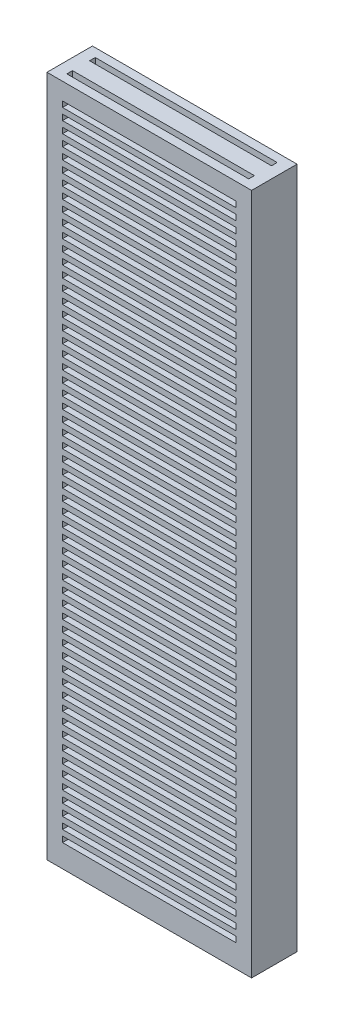
from build123d import *

# Parameters (mm, degrees)
SKETCH1_W                = 9
SKETCH1_H                = 2
BOSS_EXTRUDE1_DEPTH      = 15
SKETCH2_W                = 8
SKETCH2_H                = 0.25
CUT_EXTRUDE1_DEPTH       = 31.352100422
CUT_EXTRUDE2_REACH       = 17.788
SKETCH3_W                = 7.634272068
SKETCH3_H                = 0.25
LPATTERN1_COUNT          = 57
LPATTERN1_PITCH          = 0.5
MIRROR2_COPY_1_REACH     = 17.788
MIRROR2_COPY_1_SKETCH_W  = 7.634272068
MIRROR2_COPY_1_SKETCH_H  = 0.25
MIRROR2_COPY_2_REACH     = 17.788
MIRROR2_COPY_2_SKETCH_W  = 7.634272068
MIRROR2_COPY_2_SKETCH_H  = 0.25
MIRROR2_COPY_3_REACH     = 17.788
MIRROR2_COPY_3_SKETCH_W  = 7.634272068
MIRROR2_COPY_3_SKETCH_H  = 0.25
MIRROR2_COPY_4_REACH     = 17.788
MIRROR2_COPY_4_SKETCH_W  = 7.634272068
MIRROR2_COPY_4_SKETCH_H  = 0.25
MIRROR2_COPY_5_REACH     = 17.788
MIRROR2_COPY_5_SKETCH_W  = 7.634272068
MIRROR2_COPY_5_SKETCH_H  = 0.25
MIRROR2_COPY_6_REACH     = 17.788
MIRROR2_COPY_6_SKETCH_W  = 7.634272068
MIRROR2_COPY_6_SKETCH_H  = 0.25
MIRROR2_COPY_7_REACH     = 17.788
MIRROR2_COPY_7_SKETCH_W  = 7.634272068
MIRROR2_COPY_7_SKETCH_H  = 0.25
MIRROR2_COPY_8_REACH     = 17.788
MIRROR2_COPY_8_SKETCH_W  = 7.634272068
MIRROR2_COPY_8_SKETCH_H  = 0.25
MIRROR2_COPY_9_REACH     = 17.788
MIRROR2_COPY_9_SKETCH_W  = 7.634272068
MIRROR2_COPY_9_SKETCH_H  = 0.25
MIRROR2_COPY_10_REACH    = 17.788
MIRROR2_COPY_10_SKETCH_W = 7.634272068
MIRROR2_COPY_10_SKETCH_H = 0.25
MIRROR2_COPY_11_REACH    = 17.788
MIRROR2_COPY_11_SKETCH_W = 7.634272068
MIRROR2_COPY_11_SKETCH_H = 0.25
MIRROR2_COPY_12_REACH    = 17.788
MIRROR2_COPY_12_SKETCH_W = 7.634272068
MIRROR2_COPY_12_SKETCH_H = 0.25
MIRROR2_COPY_13_REACH    = 17.788
MIRROR2_COPY_13_SKETCH_W = 7.634272068
MIRROR2_COPY_13_SKETCH_H = 0.25
MIRROR2_COPY_14_REACH    = 17.788
MIRROR2_COPY_14_SKETCH_W = 7.634272068
MIRROR2_COPY_14_SKETCH_H = 0.25
MIRROR2_COPY_15_REACH    = 17.788
MIRROR2_COPY_15_SKETCH_W = 7.634272068
MIRROR2_COPY_15_SKETCH_H = 0.25
MIRROR2_COPY_16_REACH    = 17.788
MIRROR2_COPY_16_SKETCH_W = 7.634272068
MIRROR2_COPY_16_SKETCH_H = 0.25
MIRROR2_COPY_17_REACH    = 17.788
MIRROR2_COPY_17_SKETCH_W = 7.634272068
MIRROR2_COPY_17_SKETCH_H = 0.25
MIRROR2_COPY_18_REACH    = 17.788
MIRROR2_COPY_18_SKETCH_W = 7.634272068
MIRROR2_COPY_18_SKETCH_H = 0.25
MIRROR2_COPY_19_REACH    = 17.788
MIRROR2_COPY_19_SKETCH_W = 7.634272068
MIRROR2_COPY_19_SKETCH_H = 0.25
MIRROR2_COPY_20_REACH    = 17.788
MIRROR2_COPY_20_SKETCH_W = 7.634272068
MIRROR2_COPY_20_SKETCH_H = 0.25
MIRROR2_COPY_21_REACH    = 17.788
MIRROR2_COPY_21_SKETCH_W = 7.634272068
MIRROR2_COPY_21_SKETCH_H = 0.25
MIRROR2_COPY_22_REACH    = 17.788
MIRROR2_COPY_22_SKETCH_W = 7.634272068
MIRROR2_COPY_22_SKETCH_H = 0.25
MIRROR2_COPY_23_REACH    = 17.788
MIRROR2_COPY_23_SKETCH_W = 7.634272068
MIRROR2_COPY_23_SKETCH_H = 0.25
MIRROR2_COPY_24_REACH    = 17.788
MIRROR2_COPY_24_SKETCH_W = 7.634272068
MIRROR2_COPY_24_SKETCH_H = 0.25
MIRROR2_COPY_25_REACH    = 17.788
MIRROR2_COPY_25_SKETCH_W = 7.634272068
MIRROR2_COPY_25_SKETCH_H = 0.25
MIRROR2_COPY_26_REACH    = 17.788
MIRROR2_COPY_26_SKETCH_W = 7.634272068
MIRROR2_COPY_26_SKETCH_H = 0.25
MIRROR2_COPY_27_REACH    = 17.788
MIRROR2_COPY_27_SKETCH_W = 7.634272068
MIRROR2_COPY_27_SKETCH_H = 0.25
MIRROR2_COPY_28_REACH    = 17.788
MIRROR2_COPY_28_SKETCH_W = 7.634272068
MIRROR2_COPY_28_SKETCH_H = 0.25
MIRROR2_COPY_29_REACH    = 17.788
MIRROR2_COPY_29_SKETCH_W = 7.634272068
MIRROR2_COPY_29_SKETCH_H = 0.25
MIRROR2_COPY_30_REACH    = 17.788
MIRROR2_COPY_30_SKETCH_W = 7.634272068
MIRROR2_COPY_30_SKETCH_H = 0.25
MIRROR2_COPY_31_REACH    = 17.788
MIRROR2_COPY_31_SKETCH_W = 7.634272068
MIRROR2_COPY_31_SKETCH_H = 0.25
MIRROR2_COPY_32_REACH    = 17.788
MIRROR2_COPY_32_SKETCH_W = 7.634272068
MIRROR2_COPY_32_SKETCH_H = 0.25
MIRROR2_COPY_33_REACH    = 17.788
MIRROR2_COPY_33_SKETCH_W = 7.634272068
MIRROR2_COPY_33_SKETCH_H = 0.25
MIRROR2_COPY_34_REACH    = 17.788
MIRROR2_COPY_34_SKETCH_W = 7.634272068
MIRROR2_COPY_34_SKETCH_H = 0.25
MIRROR2_COPY_35_REACH    = 17.788
MIRROR2_COPY_35_SKETCH_W = 7.634272068
MIRROR2_COPY_35_SKETCH_H = 0.25
MIRROR2_COPY_36_REACH    = 17.788
MIRROR2_COPY_36_SKETCH_W = 7.634272068
MIRROR2_COPY_36_SKETCH_H = 0.25
MIRROR2_COPY_37_REACH    = 17.788
MIRROR2_COPY_37_SKETCH_W = 7.634272068
MIRROR2_COPY_37_SKETCH_H = 0.25
MIRROR2_COPY_38_REACH    = 17.788
MIRROR2_COPY_38_SKETCH_W = 7.634272068
MIRROR2_COPY_38_SKETCH_H = 0.25
MIRROR2_COPY_39_REACH    = 17.788
MIRROR2_COPY_39_SKETCH_W = 7.634272068
MIRROR2_COPY_39_SKETCH_H = 0.25
MIRROR2_COPY_40_REACH    = 17.788
MIRROR2_COPY_40_SKETCH_W = 7.634272068
MIRROR2_COPY_40_SKETCH_H = 0.25
MIRROR2_COPY_41_REACH    = 17.788
MIRROR2_COPY_41_SKETCH_W = 7.634272068
MIRROR2_COPY_41_SKETCH_H = 0.25
MIRROR2_COPY_42_REACH    = 17.788
MIRROR2_COPY_42_SKETCH_W = 7.634272068
MIRROR2_COPY_42_SKETCH_H = 0.25
MIRROR2_COPY_43_REACH    = 17.788
MIRROR2_COPY_43_SKETCH_W = 7.634272068
MIRROR2_COPY_43_SKETCH_H = 0.25
MIRROR2_COPY_44_REACH    = 17.788
MIRROR2_COPY_44_SKETCH_W = 7.634272068
MIRROR2_COPY_44_SKETCH_H = 0.25
MIRROR2_COPY_45_REACH    = 17.788
MIRROR2_COPY_45_SKETCH_W = 7.634272068
MIRROR2_COPY_45_SKETCH_H = 0.25
MIRROR2_COPY_46_REACH    = 17.788
MIRROR2_COPY_46_SKETCH_W = 7.634272068
MIRROR2_COPY_46_SKETCH_H = 0.25
MIRROR2_COPY_47_REACH    = 17.788
MIRROR2_COPY_47_SKETCH_W = 7.634272068
MIRROR2_COPY_47_SKETCH_H = 0.25
MIRROR2_COPY_48_REACH    = 17.788
MIRROR2_COPY_48_SKETCH_W = 7.634272068
MIRROR2_COPY_48_SKETCH_H = 0.25
MIRROR2_COPY_49_REACH    = 17.788
MIRROR2_COPY_49_SKETCH_W = 7.634272068
MIRROR2_COPY_49_SKETCH_H = 0.25
MIRROR2_COPY_50_REACH    = 17.788
MIRROR2_COPY_50_SKETCH_W = 7.634272068
MIRROR2_COPY_50_SKETCH_H = 0.25
MIRROR2_COPY_51_REACH    = 17.788
MIRROR2_COPY_51_SKETCH_W = 7.634272068
MIRROR2_COPY_51_SKETCH_H = 0.25
MIRROR2_COPY_52_REACH    = 17.788
MIRROR2_COPY_52_SKETCH_W = 7.634272068
MIRROR2_COPY_52_SKETCH_H = 0.25
MIRROR2_COPY_53_REACH    = 17.788
MIRROR2_COPY_53_SKETCH_W = 7.634272068
MIRROR2_COPY_53_SKETCH_H = 0.25
MIRROR2_COPY_54_REACH    = 17.788
MIRROR2_COPY_54_SKETCH_W = 7.634272068
MIRROR2_COPY_54_SKETCH_H = 0.25
MIRROR2_COPY_55_REACH    = 17.788
MIRROR2_COPY_55_SKETCH_W = 7.634272068
MIRROR2_COPY_55_SKETCH_H = 0.25
MIRROR2_COPY_56_REACH    = 17.788
MIRROR2_COPY_56_SKETCH_W = 7.634272068
MIRROR2_COPY_56_SKETCH_H = 0.25
MIRROR2_COPY_57_REACH    = 17.788
MIRROR2_COPY_57_SKETCH_W = 7.634272068
MIRROR2_COPY_57_SKETCH_H = 0.25


with BuildPart() as part:
    # Sketch1 → Boss-Extrude1 (new, symmetric)
    with BuildSketch(Plane(origin=(0, 0, 0), x_dir=(1, 0, 0), z_dir=(0, 1, 0))):
        Rectangle(SKETCH1_W, SKETCH1_H)
    extrude(amount=BOSS_EXTRUDE1_DEPTH, both=True)

    # Sketch2 → Cut-Extrude1 (cut, symmetric)
    with BuildSketch(Plane(origin=(0, 15, 0), x_dir=(1, 0, 0), z_dir=(0, 1, 0))):
        with Locations((0, 0.5)):
            Rectangle(SKETCH2_W, SKETCH2_H)
    cut_extrude1 = extrude(amount=CUT_EXTRUDE1_DEPTH, both=True, mode=Mode.SUBTRACT)

    # Mirror1: Cut-Extrude1 across plane
    add(cut_extrude1.mirror(Plane.XY), mode=Mode.SUBTRACT)

    # Sketch3 → Cut-Extrude2 (cut, up to next)
    with BuildSketch(Plane.XY.offset(1), mode=Mode.PRIVATE) as cut_extrude2_sk1:
        with Locations((0, 14.125)):
            Rectangle(SKETCH3_W, SKETCH3_H)
    cut_extrude2_tool1 = extrude(cut_extrude2_sk1.sketch, amount=-CUT_EXTRUDE2_REACH, mode=Mode.PRIVATE) & part.part
    cut_extrude2 = cut_extrude2_tool1.solids().sort_by_distance((0, 14.125, 1))[0]
    add(cut_extrude2, mode=Mode.SUBTRACT)

    # LPattern1: Cut-Extrude2 ×57
    with Locations(*[(0, -i * LPATTERN1_PITCH, 0) for i in range(1, LPATTERN1_COUNT)]):
        add(cut_extrude2, mode=Mode.SUBTRACT)

    # Mirror2 copy 1 sketch → Mirror2 copy 1 (cut, up to next)
    with BuildSketch(Plane(origin=(0, -0.5, -1), x_dir=(1, 0, 0), z_dir=(0, 0, -1)), mode=Mode.PRIVATE) as mirror2_copy_1_sk1:
        with Locations((0, -14.125)):
            Rectangle(MIRROR2_COPY_1_SKETCH_W, MIRROR2_COPY_1_SKETCH_H)
    mirror2_copy_1_tool1 = extrude(mirror2_copy_1_sk1.sketch, amount=-MIRROR2_COPY_1_REACH, mode=Mode.PRIVATE) & part.part
    add(mirror2_copy_1_tool1.solids().sort_by_distance((0, 13.625, -1))[0], mode=Mode.SUBTRACT)

    # Mirror2 copy 2 sketch → Mirror2 copy 2 (cut, up to next)
    with BuildSketch(Plane(origin=(0, -1, -1), x_dir=(1, 0, 0), z_dir=(0, 0, -1)), mode=Mode.PRIVATE) as mirror2_copy_2_sk1:
        with Locations((0, -14.125)):
            Rectangle(MIRROR2_COPY_2_SKETCH_W, MIRROR2_COPY_2_SKETCH_H)
    mirror2_copy_2_tool1 = extrude(mirror2_copy_2_sk1.sketch, amount=-MIRROR2_COPY_2_REACH, mode=Mode.PRIVATE) & part.part
    add(mirror2_copy_2_tool1.solids().sort_by_distance((0, 13.125, -1))[0], mode=Mode.SUBTRACT)

    # Mirror2 copy 3 sketch → Mirror2 copy 3 (cut, up to next)
    with BuildSketch(Plane(origin=(0, -1.5, -1), x_dir=(1, 0, 0), z_dir=(0, 0, -1)), mode=Mode.PRIVATE) as mirror2_copy_3_sk1:
        with Locations((0, -14.125)):
            Rectangle(MIRROR2_COPY_3_SKETCH_W, MIRROR2_COPY_3_SKETCH_H)
    mirror2_copy_3_tool1 = extrude(mirror2_copy_3_sk1.sketch, amount=-MIRROR2_COPY_3_REACH, mode=Mode.PRIVATE) & part.part
    add(mirror2_copy_3_tool1.solids().sort_by_distance((0, 12.625, -1))[0], mode=Mode.SUBTRACT)

    # Mirror2 copy 4 sketch → Mirror2 copy 4 (cut, up to next)
    with BuildSketch(Plane(origin=(0, -2, -1), x_dir=(1, 0, 0), z_dir=(0, 0, -1)), mode=Mode.PRIVATE) as mirror2_copy_4_sk1:
        with Locations((0, -14.125)):
            Rectangle(MIRROR2_COPY_4_SKETCH_W, MIRROR2_COPY_4_SKETCH_H)
    mirror2_copy_4_tool1 = extrude(mirror2_copy_4_sk1.sketch, amount=-MIRROR2_COPY_4_REACH, mode=Mode.PRIVATE) & part.part
    add(mirror2_copy_4_tool1.solids().sort_by_distance((0, 12.125, -1))[0], mode=Mode.SUBTRACT)

    # Mirror2 copy 5 sketch → Mirror2 copy 5 (cut, up to next)
    with BuildSketch(Plane(origin=(0, -2.5, -1), x_dir=(1, 0, 0), z_dir=(0, 0, -1)), mode=Mode.PRIVATE) as mirror2_copy_5_sk1:
        with Locations((0, -14.125)):
            Rectangle(MIRROR2_COPY_5_SKETCH_W, MIRROR2_COPY_5_SKETCH_H)
    mirror2_copy_5_tool1 = extrude(mirror2_copy_5_sk1.sketch, amount=-MIRROR2_COPY_5_REACH, mode=Mode.PRIVATE) & part.part
    add(mirror2_copy_5_tool1.solids().sort_by_distance((0, 11.625, -1))[0], mode=Mode.SUBTRACT)

    # Mirror2 copy 6 sketch → Mirror2 copy 6 (cut, up to next)
    with BuildSketch(Plane(origin=(0, -3, -1), x_dir=(1, 0, 0), z_dir=(0, 0, -1)), mode=Mode.PRIVATE) as mirror2_copy_6_sk1:
        with Locations((0, -14.125)):
            Rectangle(MIRROR2_COPY_6_SKETCH_W, MIRROR2_COPY_6_SKETCH_H)
    mirror2_copy_6_tool1 = extrude(mirror2_copy_6_sk1.sketch, amount=-MIRROR2_COPY_6_REACH, mode=Mode.PRIVATE) & part.part
    add(mirror2_copy_6_tool1.solids().sort_by_distance((0, 11.125, -1))[0], mode=Mode.SUBTRACT)

    # Mirror2 copy 7 sketch → Mirror2 copy 7 (cut, up to next)
    with BuildSketch(Plane(origin=(0, -3.5, -1), x_dir=(1, 0, 0), z_dir=(0, 0, -1)), mode=Mode.PRIVATE) as mirror2_copy_7_sk1:
        with Locations((0, -14.125)):
            Rectangle(MIRROR2_COPY_7_SKETCH_W, MIRROR2_COPY_7_SKETCH_H)
    mirror2_copy_7_tool1 = extrude(mirror2_copy_7_sk1.sketch, amount=-MIRROR2_COPY_7_REACH, mode=Mode.PRIVATE) & part.part
    add(mirror2_copy_7_tool1.solids().sort_by_distance((0, 10.625, -1))[0], mode=Mode.SUBTRACT)

    # Mirror2 copy 8 sketch → Mirror2 copy 8 (cut, up to next)
    with BuildSketch(Plane(origin=(0, -4, -1), x_dir=(1, 0, 0), z_dir=(0, 0, -1)), mode=Mode.PRIVATE) as mirror2_copy_8_sk1:
        with Locations((0, -14.125)):
            Rectangle(MIRROR2_COPY_8_SKETCH_W, MIRROR2_COPY_8_SKETCH_H)
    mirror2_copy_8_tool1 = extrude(mirror2_copy_8_sk1.sketch, amount=-MIRROR2_COPY_8_REACH, mode=Mode.PRIVATE) & part.part
    add(mirror2_copy_8_tool1.solids().sort_by_distance((0, 10.125, -1))[0], mode=Mode.SUBTRACT)

    # Mirror2 copy 9 sketch → Mirror2 copy 9 (cut, up to next)
    with BuildSketch(Plane(origin=(0, -4.5, -1), x_dir=(1, 0, 0), z_dir=(0, 0, -1)), mode=Mode.PRIVATE) as mirror2_copy_9_sk1:
        with Locations((0, -14.125)):
            Rectangle(MIRROR2_COPY_9_SKETCH_W, MIRROR2_COPY_9_SKETCH_H)
    mirror2_copy_9_tool1 = extrude(mirror2_copy_9_sk1.sketch, amount=-MIRROR2_COPY_9_REACH, mode=Mode.PRIVATE) & part.part
    add(mirror2_copy_9_tool1.solids().sort_by_distance((0, 9.625, -1))[0], mode=Mode.SUBTRACT)

    # Mirror2 copy 10 sketch → Mirror2 copy 10 (cut, up to next)
    with BuildSketch(Plane(origin=(0, -5, -1), x_dir=(1, 0, 0), z_dir=(0, 0, -1)), mode=Mode.PRIVATE) as mirror2_copy_10_sk1:
        with Locations((0, -14.125)):
            Rectangle(MIRROR2_COPY_10_SKETCH_W, MIRROR2_COPY_10_SKETCH_H)
    mirror2_copy_10_tool1 = extrude(mirror2_copy_10_sk1.sketch, amount=-MIRROR2_COPY_10_REACH, mode=Mode.PRIVATE) & part.part
    add(mirror2_copy_10_tool1.solids().sort_by_distance((0, 9.125, -1))[0], mode=Mode.SUBTRACT)

    # Mirror2 copy 11 sketch → Mirror2 copy 11 (cut, up to next)
    with BuildSketch(Plane(origin=(0, -5.5, -1), x_dir=(1, 0, 0), z_dir=(0, 0, -1)), mode=Mode.PRIVATE) as mirror2_copy_11_sk1:
        with Locations((0, -14.125)):
            Rectangle(MIRROR2_COPY_11_SKETCH_W, MIRROR2_COPY_11_SKETCH_H)
    mirror2_copy_11_tool1 = extrude(mirror2_copy_11_sk1.sketch, amount=-MIRROR2_COPY_11_REACH, mode=Mode.PRIVATE) & part.part
    add(mirror2_copy_11_tool1.solids().sort_by_distance((0, 8.625, -1))[0], mode=Mode.SUBTRACT)

    # Mirror2 copy 12 sketch → Mirror2 copy 12 (cut, up to next)
    with BuildSketch(Plane(origin=(0, -6, -1), x_dir=(1, 0, 0), z_dir=(0, 0, -1)), mode=Mode.PRIVATE) as mirror2_copy_12_sk1:
        with Locations((0, -14.125)):
            Rectangle(MIRROR2_COPY_12_SKETCH_W, MIRROR2_COPY_12_SKETCH_H)
    mirror2_copy_12_tool1 = extrude(mirror2_copy_12_sk1.sketch, amount=-MIRROR2_COPY_12_REACH, mode=Mode.PRIVATE) & part.part
    add(mirror2_copy_12_tool1.solids().sort_by_distance((0, 8.125, -1))[0], mode=Mode.SUBTRACT)

    # Mirror2 copy 13 sketch → Mirror2 copy 13 (cut, up to next)
    with BuildSketch(Plane(origin=(0, -6.5, -1), x_dir=(1, 0, 0), z_dir=(0, 0, -1)), mode=Mode.PRIVATE) as mirror2_copy_13_sk1:
        with Locations((0, -14.125)):
            Rectangle(MIRROR2_COPY_13_SKETCH_W, MIRROR2_COPY_13_SKETCH_H)
    mirror2_copy_13_tool1 = extrude(mirror2_copy_13_sk1.sketch, amount=-MIRROR2_COPY_13_REACH, mode=Mode.PRIVATE) & part.part
    add(mirror2_copy_13_tool1.solids().sort_by_distance((0, 7.625, -1))[0], mode=Mode.SUBTRACT)

    # Mirror2 copy 14 sketch → Mirror2 copy 14 (cut, up to next)
    with BuildSketch(Plane(origin=(0, -7, -1), x_dir=(1, 0, 0), z_dir=(0, 0, -1)), mode=Mode.PRIVATE) as mirror2_copy_14_sk1:
        with Locations((0, -14.125)):
            Rectangle(MIRROR2_COPY_14_SKETCH_W, MIRROR2_COPY_14_SKETCH_H)
    mirror2_copy_14_tool1 = extrude(mirror2_copy_14_sk1.sketch, amount=-MIRROR2_COPY_14_REACH, mode=Mode.PRIVATE) & part.part
    add(mirror2_copy_14_tool1.solids().sort_by_distance((0, 7.125, -1))[0], mode=Mode.SUBTRACT)

    # Mirror2 copy 15 sketch → Mirror2 copy 15 (cut, up to next)
    with BuildSketch(Plane(origin=(0, -7.5, -1), x_dir=(1, 0, 0), z_dir=(0, 0, -1)), mode=Mode.PRIVATE) as mirror2_copy_15_sk1:
        with Locations((0, -14.125)):
            Rectangle(MIRROR2_COPY_15_SKETCH_W, MIRROR2_COPY_15_SKETCH_H)
    mirror2_copy_15_tool1 = extrude(mirror2_copy_15_sk1.sketch, amount=-MIRROR2_COPY_15_REACH, mode=Mode.PRIVATE) & part.part
    add(mirror2_copy_15_tool1.solids().sort_by_distance((0, 6.625, -1))[0], mode=Mode.SUBTRACT)

    # Mirror2 copy 16 sketch → Mirror2 copy 16 (cut, up to next)
    with BuildSketch(Plane(origin=(0, -8, -1), x_dir=(1, 0, 0), z_dir=(0, 0, -1)), mode=Mode.PRIVATE) as mirror2_copy_16_sk1:
        with Locations((0, -14.125)):
            Rectangle(MIRROR2_COPY_16_SKETCH_W, MIRROR2_COPY_16_SKETCH_H)
    mirror2_copy_16_tool1 = extrude(mirror2_copy_16_sk1.sketch, amount=-MIRROR2_COPY_16_REACH, mode=Mode.PRIVATE) & part.part
    add(mirror2_copy_16_tool1.solids().sort_by_distance((0, 6.125, -1))[0], mode=Mode.SUBTRACT)

    # Mirror2 copy 17 sketch → Mirror2 copy 17 (cut, up to next)
    with BuildSketch(Plane(origin=(0, -8.5, -1), x_dir=(1, 0, 0), z_dir=(0, 0, -1)), mode=Mode.PRIVATE) as mirror2_copy_17_sk1:
        with Locations((0, -14.125)):
            Rectangle(MIRROR2_COPY_17_SKETCH_W, MIRROR2_COPY_17_SKETCH_H)
    mirror2_copy_17_tool1 = extrude(mirror2_copy_17_sk1.sketch, amount=-MIRROR2_COPY_17_REACH, mode=Mode.PRIVATE) & part.part
    add(mirror2_copy_17_tool1.solids().sort_by_distance((0, 5.625, -1))[0], mode=Mode.SUBTRACT)

    # Mirror2 copy 18 sketch → Mirror2 copy 18 (cut, up to next)
    with BuildSketch(Plane(origin=(0, -9, -1), x_dir=(1, 0, 0), z_dir=(0, 0, -1)), mode=Mode.PRIVATE) as mirror2_copy_18_sk1:
        with Locations((0, -14.125)):
            Rectangle(MIRROR2_COPY_18_SKETCH_W, MIRROR2_COPY_18_SKETCH_H)
    mirror2_copy_18_tool1 = extrude(mirror2_copy_18_sk1.sketch, amount=-MIRROR2_COPY_18_REACH, mode=Mode.PRIVATE) & part.part
    add(mirror2_copy_18_tool1.solids().sort_by_distance((0, 5.125, -1))[0], mode=Mode.SUBTRACT)

    # Mirror2 copy 19 sketch → Mirror2 copy 19 (cut, up to next)
    with BuildSketch(Plane(origin=(0, -9.5, -1), x_dir=(1, 0, 0), z_dir=(0, 0, -1)), mode=Mode.PRIVATE) as mirror2_copy_19_sk1:
        with Locations((0, -14.125)):
            Rectangle(MIRROR2_COPY_19_SKETCH_W, MIRROR2_COPY_19_SKETCH_H)
    mirror2_copy_19_tool1 = extrude(mirror2_copy_19_sk1.sketch, amount=-MIRROR2_COPY_19_REACH, mode=Mode.PRIVATE) & part.part
    add(mirror2_copy_19_tool1.solids().sort_by_distance((0, 4.625, -1))[0], mode=Mode.SUBTRACT)

    # Mirror2 copy 20 sketch → Mirror2 copy 20 (cut, up to next)
    with BuildSketch(Plane(origin=(0, -10, -1), x_dir=(1, 0, 0), z_dir=(0, 0, -1)), mode=Mode.PRIVATE) as mirror2_copy_20_sk1:
        with Locations((0, -14.125)):
            Rectangle(MIRROR2_COPY_20_SKETCH_W, MIRROR2_COPY_20_SKETCH_H)
    mirror2_copy_20_tool1 = extrude(mirror2_copy_20_sk1.sketch, amount=-MIRROR2_COPY_20_REACH, mode=Mode.PRIVATE) & part.part
    add(mirror2_copy_20_tool1.solids().sort_by_distance((0, 4.125, -1))[0], mode=Mode.SUBTRACT)

    # Mirror2 copy 21 sketch → Mirror2 copy 21 (cut, up to next)
    with BuildSketch(Plane(origin=(0, -10.5, -1), x_dir=(1, 0, 0), z_dir=(0, 0, -1)), mode=Mode.PRIVATE) as mirror2_copy_21_sk1:
        with Locations((0, -14.125)):
            Rectangle(MIRROR2_COPY_21_SKETCH_W, MIRROR2_COPY_21_SKETCH_H)
    mirror2_copy_21_tool1 = extrude(mirror2_copy_21_sk1.sketch, amount=-MIRROR2_COPY_21_REACH, mode=Mode.PRIVATE) & part.part
    add(mirror2_copy_21_tool1.solids().sort_by_distance((0, 3.625, -1))[0], mode=Mode.SUBTRACT)

    # Mirror2 copy 22 sketch → Mirror2 copy 22 (cut, up to next)
    with BuildSketch(Plane(origin=(0, -11, -1), x_dir=(1, 0, 0), z_dir=(0, 0, -1)), mode=Mode.PRIVATE) as mirror2_copy_22_sk1:
        with Locations((0, -14.125)):
            Rectangle(MIRROR2_COPY_22_SKETCH_W, MIRROR2_COPY_22_SKETCH_H)
    mirror2_copy_22_tool1 = extrude(mirror2_copy_22_sk1.sketch, amount=-MIRROR2_COPY_22_REACH, mode=Mode.PRIVATE) & part.part
    add(mirror2_copy_22_tool1.solids().sort_by_distance((0, 3.125, -1))[0], mode=Mode.SUBTRACT)

    # Mirror2 copy 23 sketch → Mirror2 copy 23 (cut, up to next)
    with BuildSketch(Plane(origin=(0, -11.5, -1), x_dir=(1, 0, 0), z_dir=(0, 0, -1)), mode=Mode.PRIVATE) as mirror2_copy_23_sk1:
        with Locations((0, -14.125)):
            Rectangle(MIRROR2_COPY_23_SKETCH_W, MIRROR2_COPY_23_SKETCH_H)
    mirror2_copy_23_tool1 = extrude(mirror2_copy_23_sk1.sketch, amount=-MIRROR2_COPY_23_REACH, mode=Mode.PRIVATE) & part.part
    add(mirror2_copy_23_tool1.solids().sort_by_distance((0, 2.625, -1))[0], mode=Mode.SUBTRACT)

    # Mirror2 copy 24 sketch → Mirror2 copy 24 (cut, up to next)
    with BuildSketch(Plane(origin=(0, -12, -1), x_dir=(1, 0, 0), z_dir=(0, 0, -1)), mode=Mode.PRIVATE) as mirror2_copy_24_sk1:
        with Locations((0, -14.125)):
            Rectangle(MIRROR2_COPY_24_SKETCH_W, MIRROR2_COPY_24_SKETCH_H)
    mirror2_copy_24_tool1 = extrude(mirror2_copy_24_sk1.sketch, amount=-MIRROR2_COPY_24_REACH, mode=Mode.PRIVATE) & part.part
    add(mirror2_copy_24_tool1.solids().sort_by_distance((0, 2.125, -1))[0], mode=Mode.SUBTRACT)

    # Mirror2 copy 25 sketch → Mirror2 copy 25 (cut, up to next)
    with BuildSketch(Plane(origin=(0, -12.5, -1), x_dir=(1, 0, 0), z_dir=(0, 0, -1)), mode=Mode.PRIVATE) as mirror2_copy_25_sk1:
        with Locations((0, -14.125)):
            Rectangle(MIRROR2_COPY_25_SKETCH_W, MIRROR2_COPY_25_SKETCH_H)
    mirror2_copy_25_tool1 = extrude(mirror2_copy_25_sk1.sketch, amount=-MIRROR2_COPY_25_REACH, mode=Mode.PRIVATE) & part.part
    add(mirror2_copy_25_tool1.solids().sort_by_distance((0, 1.625, -1))[0], mode=Mode.SUBTRACT)

    # Mirror2 copy 26 sketch → Mirror2 copy 26 (cut, up to next)
    with BuildSketch(Plane(origin=(0, -13, -1), x_dir=(1, 0, 0), z_dir=(0, 0, -1)), mode=Mode.PRIVATE) as mirror2_copy_26_sk1:
        with Locations((0, -14.125)):
            Rectangle(MIRROR2_COPY_26_SKETCH_W, MIRROR2_COPY_26_SKETCH_H)
    mirror2_copy_26_tool1 = extrude(mirror2_copy_26_sk1.sketch, amount=-MIRROR2_COPY_26_REACH, mode=Mode.PRIVATE) & part.part
    add(mirror2_copy_26_tool1.solids().sort_by_distance((0, 1.125, -1))[0], mode=Mode.SUBTRACT)

    # Mirror2 copy 27 sketch → Mirror2 copy 27 (cut, up to next)
    with BuildSketch(Plane(origin=(0, -13.5, -1), x_dir=(1, 0, 0), z_dir=(0, 0, -1)), mode=Mode.PRIVATE) as mirror2_copy_27_sk1:
        with Locations((0, -14.125)):
            Rectangle(MIRROR2_COPY_27_SKETCH_W, MIRROR2_COPY_27_SKETCH_H)
    mirror2_copy_27_tool1 = extrude(mirror2_copy_27_sk1.sketch, amount=-MIRROR2_COPY_27_REACH, mode=Mode.PRIVATE) & part.part
    add(mirror2_copy_27_tool1.solids().sort_by_distance((0, 0.625, -1))[0], mode=Mode.SUBTRACT)

    # Mirror2 copy 28 sketch → Mirror2 copy 28 (cut, up to next)
    with BuildSketch(Plane(origin=(0, -14, -1), x_dir=(1, 0, 0), z_dir=(0, 0, -1)), mode=Mode.PRIVATE) as mirror2_copy_28_sk1:
        with Locations((0, -14.125)):
            Rectangle(MIRROR2_COPY_28_SKETCH_W, MIRROR2_COPY_28_SKETCH_H)
    mirror2_copy_28_tool1 = extrude(mirror2_copy_28_sk1.sketch, amount=-MIRROR2_COPY_28_REACH, mode=Mode.PRIVATE) & part.part
    add(mirror2_copy_28_tool1.solids().sort_by_distance((0, 0.125, -1))[0], mode=Mode.SUBTRACT)

    # Mirror2 copy 29 sketch → Mirror2 copy 29 (cut, up to next)
    with BuildSketch(Plane(origin=(0, -14.5, -1), x_dir=(1, 0, 0), z_dir=(0, 0, -1)), mode=Mode.PRIVATE) as mirror2_copy_29_sk1:
        with Locations((0, -14.125)):
            Rectangle(MIRROR2_COPY_29_SKETCH_W, MIRROR2_COPY_29_SKETCH_H)
    mirror2_copy_29_tool1 = extrude(mirror2_copy_29_sk1.sketch, amount=-MIRROR2_COPY_29_REACH, mode=Mode.PRIVATE) & part.part
    add(mirror2_copy_29_tool1.solids().sort_by_distance((0, -0.375, -1))[0], mode=Mode.SUBTRACT)

    # Mirror2 copy 30 sketch → Mirror2 copy 30 (cut, up to next)
    with BuildSketch(Plane(origin=(0, -15, -1), x_dir=(1, 0, 0), z_dir=(0, 0, -1)), mode=Mode.PRIVATE) as mirror2_copy_30_sk1:
        with Locations((0, -14.125)):
            Rectangle(MIRROR2_COPY_30_SKETCH_W, MIRROR2_COPY_30_SKETCH_H)
    mirror2_copy_30_tool1 = extrude(mirror2_copy_30_sk1.sketch, amount=-MIRROR2_COPY_30_REACH, mode=Mode.PRIVATE) & part.part
    add(mirror2_copy_30_tool1.solids().sort_by_distance((0, -0.875, -1))[0], mode=Mode.SUBTRACT)

    # Mirror2 copy 31 sketch → Mirror2 copy 31 (cut, up to next)
    with BuildSketch(Plane(origin=(0, -15.5, -1), x_dir=(1, 0, 0), z_dir=(0, 0, -1)), mode=Mode.PRIVATE) as mirror2_copy_31_sk1:
        with Locations((0, -14.125)):
            Rectangle(MIRROR2_COPY_31_SKETCH_W, MIRROR2_COPY_31_SKETCH_H)
    mirror2_copy_31_tool1 = extrude(mirror2_copy_31_sk1.sketch, amount=-MIRROR2_COPY_31_REACH, mode=Mode.PRIVATE) & part.part
    add(mirror2_copy_31_tool1.solids().sort_by_distance((0, -1.375, -1))[0], mode=Mode.SUBTRACT)

    # Mirror2 copy 32 sketch → Mirror2 copy 32 (cut, up to next)
    with BuildSketch(Plane(origin=(0, -16, -1), x_dir=(1, 0, 0), z_dir=(0, 0, -1)), mode=Mode.PRIVATE) as mirror2_copy_32_sk1:
        with Locations((0, -14.125)):
            Rectangle(MIRROR2_COPY_32_SKETCH_W, MIRROR2_COPY_32_SKETCH_H)
    mirror2_copy_32_tool1 = extrude(mirror2_copy_32_sk1.sketch, amount=-MIRROR2_COPY_32_REACH, mode=Mode.PRIVATE) & part.part
    add(mirror2_copy_32_tool1.solids().sort_by_distance((0, -1.875, -1))[0], mode=Mode.SUBTRACT)

    # Mirror2 copy 33 sketch → Mirror2 copy 33 (cut, up to next)
    with BuildSketch(Plane(origin=(0, -16.5, -1), x_dir=(1, 0, 0), z_dir=(0, 0, -1)), mode=Mode.PRIVATE) as mirror2_copy_33_sk1:
        with Locations((0, -14.125)):
            Rectangle(MIRROR2_COPY_33_SKETCH_W, MIRROR2_COPY_33_SKETCH_H)
    mirror2_copy_33_tool1 = extrude(mirror2_copy_33_sk1.sketch, amount=-MIRROR2_COPY_33_REACH, mode=Mode.PRIVATE) & part.part
    add(mirror2_copy_33_tool1.solids().sort_by_distance((0, -2.375, -1))[0], mode=Mode.SUBTRACT)

    # Mirror2 copy 34 sketch → Mirror2 copy 34 (cut, up to next)
    with BuildSketch(Plane(origin=(0, -17, -1), x_dir=(1, 0, 0), z_dir=(0, 0, -1)), mode=Mode.PRIVATE) as mirror2_copy_34_sk1:
        with Locations((0, -14.125)):
            Rectangle(MIRROR2_COPY_34_SKETCH_W, MIRROR2_COPY_34_SKETCH_H)
    mirror2_copy_34_tool1 = extrude(mirror2_copy_34_sk1.sketch, amount=-MIRROR2_COPY_34_REACH, mode=Mode.PRIVATE) & part.part
    add(mirror2_copy_34_tool1.solids().sort_by_distance((0, -2.875, -1))[0], mode=Mode.SUBTRACT)

    # Mirror2 copy 35 sketch → Mirror2 copy 35 (cut, up to next)
    with BuildSketch(Plane(origin=(0, -17.5, -1), x_dir=(1, 0, 0), z_dir=(0, 0, -1)), mode=Mode.PRIVATE) as mirror2_copy_35_sk1:
        with Locations((0, -14.125)):
            Rectangle(MIRROR2_COPY_35_SKETCH_W, MIRROR2_COPY_35_SKETCH_H)
    mirror2_copy_35_tool1 = extrude(mirror2_copy_35_sk1.sketch, amount=-MIRROR2_COPY_35_REACH, mode=Mode.PRIVATE) & part.part
    add(mirror2_copy_35_tool1.solids().sort_by_distance((0, -3.375, -1))[0], mode=Mode.SUBTRACT)

    # Mirror2 copy 36 sketch → Mirror2 copy 36 (cut, up to next)
    with BuildSketch(Plane(origin=(0, -18, -1), x_dir=(1, 0, 0), z_dir=(0, 0, -1)), mode=Mode.PRIVATE) as mirror2_copy_36_sk1:
        with Locations((0, -14.125)):
            Rectangle(MIRROR2_COPY_36_SKETCH_W, MIRROR2_COPY_36_SKETCH_H)
    mirror2_copy_36_tool1 = extrude(mirror2_copy_36_sk1.sketch, amount=-MIRROR2_COPY_36_REACH, mode=Mode.PRIVATE) & part.part
    add(mirror2_copy_36_tool1.solids().sort_by_distance((0, -3.875, -1))[0], mode=Mode.SUBTRACT)

    # Mirror2 copy 37 sketch → Mirror2 copy 37 (cut, up to next)
    with BuildSketch(Plane(origin=(0, -18.5, -1), x_dir=(1, 0, 0), z_dir=(0, 0, -1)), mode=Mode.PRIVATE) as mirror2_copy_37_sk1:
        with Locations((0, -14.125)):
            Rectangle(MIRROR2_COPY_37_SKETCH_W, MIRROR2_COPY_37_SKETCH_H)
    mirror2_copy_37_tool1 = extrude(mirror2_copy_37_sk1.sketch, amount=-MIRROR2_COPY_37_REACH, mode=Mode.PRIVATE) & part.part
    add(mirror2_copy_37_tool1.solids().sort_by_distance((0, -4.375, -1))[0], mode=Mode.SUBTRACT)

    # Mirror2 copy 38 sketch → Mirror2 copy 38 (cut, up to next)
    with BuildSketch(Plane(origin=(0, -19, -1), x_dir=(1, 0, 0), z_dir=(0, 0, -1)), mode=Mode.PRIVATE) as mirror2_copy_38_sk1:
        with Locations((0, -14.125)):
            Rectangle(MIRROR2_COPY_38_SKETCH_W, MIRROR2_COPY_38_SKETCH_H)
    mirror2_copy_38_tool1 = extrude(mirror2_copy_38_sk1.sketch, amount=-MIRROR2_COPY_38_REACH, mode=Mode.PRIVATE) & part.part
    add(mirror2_copy_38_tool1.solids().sort_by_distance((0, -4.875, -1))[0], mode=Mode.SUBTRACT)

    # Mirror2 copy 39 sketch → Mirror2 copy 39 (cut, up to next)
    with BuildSketch(Plane(origin=(0, -19.5, -1), x_dir=(1, 0, 0), z_dir=(0, 0, -1)), mode=Mode.PRIVATE) as mirror2_copy_39_sk1:
        with Locations((0, -14.125)):
            Rectangle(MIRROR2_COPY_39_SKETCH_W, MIRROR2_COPY_39_SKETCH_H)
    mirror2_copy_39_tool1 = extrude(mirror2_copy_39_sk1.sketch, amount=-MIRROR2_COPY_39_REACH, mode=Mode.PRIVATE) & part.part
    add(mirror2_copy_39_tool1.solids().sort_by_distance((0, -5.375, -1))[0], mode=Mode.SUBTRACT)

    # Mirror2 copy 40 sketch → Mirror2 copy 40 (cut, up to next)
    with BuildSketch(Plane(origin=(0, -20, -1), x_dir=(1, 0, 0), z_dir=(0, 0, -1)), mode=Mode.PRIVATE) as mirror2_copy_40_sk1:
        with Locations((0, -14.125)):
            Rectangle(MIRROR2_COPY_40_SKETCH_W, MIRROR2_COPY_40_SKETCH_H)
    mirror2_copy_40_tool1 = extrude(mirror2_copy_40_sk1.sketch, amount=-MIRROR2_COPY_40_REACH, mode=Mode.PRIVATE) & part.part
    add(mirror2_copy_40_tool1.solids().sort_by_distance((0, -5.875, -1))[0], mode=Mode.SUBTRACT)

    # Mirror2 copy 41 sketch → Mirror2 copy 41 (cut, up to next)
    with BuildSketch(Plane(origin=(0, -20.5, -1), x_dir=(1, 0, 0), z_dir=(0, 0, -1)), mode=Mode.PRIVATE) as mirror2_copy_41_sk1:
        with Locations((0, -14.125)):
            Rectangle(MIRROR2_COPY_41_SKETCH_W, MIRROR2_COPY_41_SKETCH_H)
    mirror2_copy_41_tool1 = extrude(mirror2_copy_41_sk1.sketch, amount=-MIRROR2_COPY_41_REACH, mode=Mode.PRIVATE) & part.part
    add(mirror2_copy_41_tool1.solids().sort_by_distance((0, -6.375, -1))[0], mode=Mode.SUBTRACT)

    # Mirror2 copy 42 sketch → Mirror2 copy 42 (cut, up to next)
    with BuildSketch(Plane(origin=(0, -21, -1), x_dir=(1, 0, 0), z_dir=(0, 0, -1)), mode=Mode.PRIVATE) as mirror2_copy_42_sk1:
        with Locations((0, -14.125)):
            Rectangle(MIRROR2_COPY_42_SKETCH_W, MIRROR2_COPY_42_SKETCH_H)
    mirror2_copy_42_tool1 = extrude(mirror2_copy_42_sk1.sketch, amount=-MIRROR2_COPY_42_REACH, mode=Mode.PRIVATE) & part.part
    add(mirror2_copy_42_tool1.solids().sort_by_distance((0, -6.875, -1))[0], mode=Mode.SUBTRACT)

    # Mirror2 copy 43 sketch → Mirror2 copy 43 (cut, up to next)
    with BuildSketch(Plane(origin=(0, -21.5, -1), x_dir=(1, 0, 0), z_dir=(0, 0, -1)), mode=Mode.PRIVATE) as mirror2_copy_43_sk1:
        with Locations((0, -14.125)):
            Rectangle(MIRROR2_COPY_43_SKETCH_W, MIRROR2_COPY_43_SKETCH_H)
    mirror2_copy_43_tool1 = extrude(mirror2_copy_43_sk1.sketch, amount=-MIRROR2_COPY_43_REACH, mode=Mode.PRIVATE) & part.part
    add(mirror2_copy_43_tool1.solids().sort_by_distance((0, -7.375, -1))[0], mode=Mode.SUBTRACT)

    # Mirror2 copy 44 sketch → Mirror2 copy 44 (cut, up to next)
    with BuildSketch(Plane(origin=(0, -22, -1), x_dir=(1, 0, 0), z_dir=(0, 0, -1)), mode=Mode.PRIVATE) as mirror2_copy_44_sk1:
        with Locations((0, -14.125)):
            Rectangle(MIRROR2_COPY_44_SKETCH_W, MIRROR2_COPY_44_SKETCH_H)
    mirror2_copy_44_tool1 = extrude(mirror2_copy_44_sk1.sketch, amount=-MIRROR2_COPY_44_REACH, mode=Mode.PRIVATE) & part.part
    add(mirror2_copy_44_tool1.solids().sort_by_distance((0, -7.875, -1))[0], mode=Mode.SUBTRACT)

    # Mirror2 copy 45 sketch → Mirror2 copy 45 (cut, up to next)
    with BuildSketch(Plane(origin=(0, -22.5, -1), x_dir=(1, 0, 0), z_dir=(0, 0, -1)), mode=Mode.PRIVATE) as mirror2_copy_45_sk1:
        with Locations((0, -14.125)):
            Rectangle(MIRROR2_COPY_45_SKETCH_W, MIRROR2_COPY_45_SKETCH_H)
    mirror2_copy_45_tool1 = extrude(mirror2_copy_45_sk1.sketch, amount=-MIRROR2_COPY_45_REACH, mode=Mode.PRIVATE) & part.part
    add(mirror2_copy_45_tool1.solids().sort_by_distance((0, -8.375, -1))[0], mode=Mode.SUBTRACT)

    # Mirror2 copy 46 sketch → Mirror2 copy 46 (cut, up to next)
    with BuildSketch(Plane(origin=(0, -23, -1), x_dir=(1, 0, 0), z_dir=(0, 0, -1)), mode=Mode.PRIVATE) as mirror2_copy_46_sk1:
        with Locations((0, -14.125)):
            Rectangle(MIRROR2_COPY_46_SKETCH_W, MIRROR2_COPY_46_SKETCH_H)
    mirror2_copy_46_tool1 = extrude(mirror2_copy_46_sk1.sketch, amount=-MIRROR2_COPY_46_REACH, mode=Mode.PRIVATE) & part.part
    add(mirror2_copy_46_tool1.solids().sort_by_distance((0, -8.875, -1))[0], mode=Mode.SUBTRACT)

    # Mirror2 copy 47 sketch → Mirror2 copy 47 (cut, up to next)
    with BuildSketch(Plane(origin=(0, -23.5, -1), x_dir=(1, 0, 0), z_dir=(0, 0, -1)), mode=Mode.PRIVATE) as mirror2_copy_47_sk1:
        with Locations((0, -14.125)):
            Rectangle(MIRROR2_COPY_47_SKETCH_W, MIRROR2_COPY_47_SKETCH_H)
    mirror2_copy_47_tool1 = extrude(mirror2_copy_47_sk1.sketch, amount=-MIRROR2_COPY_47_REACH, mode=Mode.PRIVATE) & part.part
    add(mirror2_copy_47_tool1.solids().sort_by_distance((0, -9.375, -1))[0], mode=Mode.SUBTRACT)

    # Mirror2 copy 48 sketch → Mirror2 copy 48 (cut, up to next)
    with BuildSketch(Plane(origin=(0, -24, -1), x_dir=(1, 0, 0), z_dir=(0, 0, -1)), mode=Mode.PRIVATE) as mirror2_copy_48_sk1:
        with Locations((0, -14.125)):
            Rectangle(MIRROR2_COPY_48_SKETCH_W, MIRROR2_COPY_48_SKETCH_H)
    mirror2_copy_48_tool1 = extrude(mirror2_copy_48_sk1.sketch, amount=-MIRROR2_COPY_48_REACH, mode=Mode.PRIVATE) & part.part
    add(mirror2_copy_48_tool1.solids().sort_by_distance((0, -9.875, -1))[0], mode=Mode.SUBTRACT)

    # Mirror2 copy 49 sketch → Mirror2 copy 49 (cut, up to next)
    with BuildSketch(Plane(origin=(0, -24.5, -1), x_dir=(1, 0, 0), z_dir=(0, 0, -1)), mode=Mode.PRIVATE) as mirror2_copy_49_sk1:
        with Locations((0, -14.125)):
            Rectangle(MIRROR2_COPY_49_SKETCH_W, MIRROR2_COPY_49_SKETCH_H)
    mirror2_copy_49_tool1 = extrude(mirror2_copy_49_sk1.sketch, amount=-MIRROR2_COPY_49_REACH, mode=Mode.PRIVATE) & part.part
    add(mirror2_copy_49_tool1.solids().sort_by_distance((0, -10.375, -1))[0], mode=Mode.SUBTRACT)

    # Mirror2 copy 50 sketch → Mirror2 copy 50 (cut, up to next)
    with BuildSketch(Plane(origin=(0, -25, -1), x_dir=(1, 0, 0), z_dir=(0, 0, -1)), mode=Mode.PRIVATE) as mirror2_copy_50_sk1:
        with Locations((0, -14.125)):
            Rectangle(MIRROR2_COPY_50_SKETCH_W, MIRROR2_COPY_50_SKETCH_H)
    mirror2_copy_50_tool1 = extrude(mirror2_copy_50_sk1.sketch, amount=-MIRROR2_COPY_50_REACH, mode=Mode.PRIVATE) & part.part
    add(mirror2_copy_50_tool1.solids().sort_by_distance((0, -10.875, -1))[0], mode=Mode.SUBTRACT)

    # Mirror2 copy 51 sketch → Mirror2 copy 51 (cut, up to next)
    with BuildSketch(Plane(origin=(0, -25.5, -1), x_dir=(1, 0, 0), z_dir=(0, 0, -1)), mode=Mode.PRIVATE) as mirror2_copy_51_sk1:
        with Locations((0, -14.125)):
            Rectangle(MIRROR2_COPY_51_SKETCH_W, MIRROR2_COPY_51_SKETCH_H)
    mirror2_copy_51_tool1 = extrude(mirror2_copy_51_sk1.sketch, amount=-MIRROR2_COPY_51_REACH, mode=Mode.PRIVATE) & part.part
    add(mirror2_copy_51_tool1.solids().sort_by_distance((0, -11.375, -1))[0], mode=Mode.SUBTRACT)

    # Mirror2 copy 52 sketch → Mirror2 copy 52 (cut, up to next)
    with BuildSketch(Plane(origin=(0, -26, -1), x_dir=(1, 0, 0), z_dir=(0, 0, -1)), mode=Mode.PRIVATE) as mirror2_copy_52_sk1:
        with Locations((0, -14.125)):
            Rectangle(MIRROR2_COPY_52_SKETCH_W, MIRROR2_COPY_52_SKETCH_H)
    mirror2_copy_52_tool1 = extrude(mirror2_copy_52_sk1.sketch, amount=-MIRROR2_COPY_52_REACH, mode=Mode.PRIVATE) & part.part
    add(mirror2_copy_52_tool1.solids().sort_by_distance((0, -11.875, -1))[0], mode=Mode.SUBTRACT)

    # Mirror2 copy 53 sketch → Mirror2 copy 53 (cut, up to next)
    with BuildSketch(Plane(origin=(0, -26.5, -1), x_dir=(1, 0, 0), z_dir=(0, 0, -1)), mode=Mode.PRIVATE) as mirror2_copy_53_sk1:
        with Locations((0, -14.125)):
            Rectangle(MIRROR2_COPY_53_SKETCH_W, MIRROR2_COPY_53_SKETCH_H)
    mirror2_copy_53_tool1 = extrude(mirror2_copy_53_sk1.sketch, amount=-MIRROR2_COPY_53_REACH, mode=Mode.PRIVATE) & part.part
    add(mirror2_copy_53_tool1.solids().sort_by_distance((0, -12.375, -1))[0], mode=Mode.SUBTRACT)

    # Mirror2 copy 54 sketch → Mirror2 copy 54 (cut, up to next)
    with BuildSketch(Plane(origin=(0, -27, -1), x_dir=(1, 0, 0), z_dir=(0, 0, -1)), mode=Mode.PRIVATE) as mirror2_copy_54_sk1:
        with Locations((0, -14.125)):
            Rectangle(MIRROR2_COPY_54_SKETCH_W, MIRROR2_COPY_54_SKETCH_H)
    mirror2_copy_54_tool1 = extrude(mirror2_copy_54_sk1.sketch, amount=-MIRROR2_COPY_54_REACH, mode=Mode.PRIVATE) & part.part
    add(mirror2_copy_54_tool1.solids().sort_by_distance((0, -12.875, -1))[0], mode=Mode.SUBTRACT)

    # Mirror2 copy 55 sketch → Mirror2 copy 55 (cut, up to next)
    with BuildSketch(Plane(origin=(0, -27.5, -1), x_dir=(1, 0, 0), z_dir=(0, 0, -1)), mode=Mode.PRIVATE) as mirror2_copy_55_sk1:
        with Locations((0, -14.125)):
            Rectangle(MIRROR2_COPY_55_SKETCH_W, MIRROR2_COPY_55_SKETCH_H)
    mirror2_copy_55_tool1 = extrude(mirror2_copy_55_sk1.sketch, amount=-MIRROR2_COPY_55_REACH, mode=Mode.PRIVATE) & part.part
    add(mirror2_copy_55_tool1.solids().sort_by_distance((0, -13.375, -1))[0], mode=Mode.SUBTRACT)

    # Mirror2 copy 56 sketch → Mirror2 copy 56 (cut, up to next)
    with BuildSketch(Plane(origin=(0, -28, -1), x_dir=(1, 0, 0), z_dir=(0, 0, -1)), mode=Mode.PRIVATE) as mirror2_copy_56_sk1:
        with Locations((0, -14.125)):
            Rectangle(MIRROR2_COPY_56_SKETCH_W, MIRROR2_COPY_56_SKETCH_H)
    mirror2_copy_56_tool1 = extrude(mirror2_copy_56_sk1.sketch, amount=-MIRROR2_COPY_56_REACH, mode=Mode.PRIVATE) & part.part
    add(mirror2_copy_56_tool1.solids().sort_by_distance((0, -13.875, -1))[0], mode=Mode.SUBTRACT)

    # Mirror2 copy 57 sketch → Mirror2 copy 57 (cut, up to next)
    with BuildSketch(Plane(origin=(0, 0, -1), x_dir=(1, 0, 0), z_dir=(0, 0, -1)), mode=Mode.PRIVATE) as mirror2_copy_57_sk1:
        with Locations((0, -14.125)):
            Rectangle(MIRROR2_COPY_57_SKETCH_W, MIRROR2_COPY_57_SKETCH_H)
    mirror2_copy_57_tool1 = extrude(mirror2_copy_57_sk1.sketch, amount=-MIRROR2_COPY_57_REACH, mode=Mode.PRIVATE) & part.part
    add(mirror2_copy_57_tool1.solids().sort_by_distance((0, 14.125, -1))[0], mode=Mode.SUBTRACT)


solid = part.part
